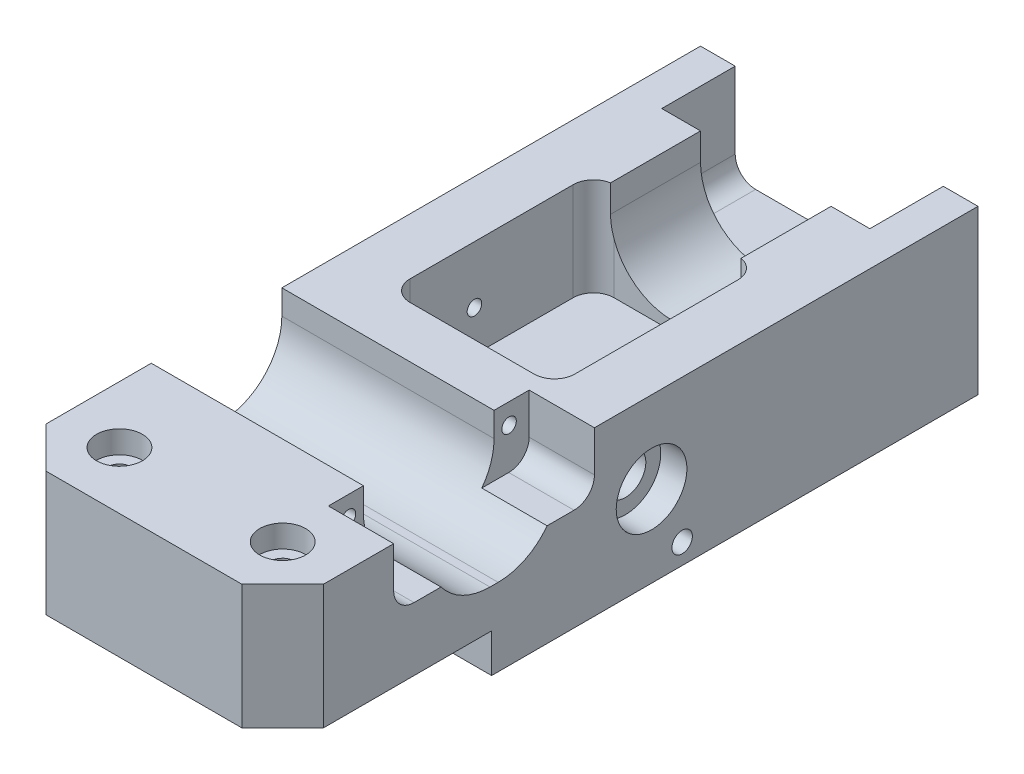
from build123d import *

# Parameters (mm, degrees)
BASE_DEPTH                    = 12.7
BASE_DEPTH_BACK               = 12.7
SKETCH1_W                     = 43.18
SKETCH1_H                     = 108.204
ACTUATORPLANECUT_DEPTH        = 6.0325
CENTERSLOT_DEPTH              = 60.619162222
CENTERSLOT_DEPTH_BACK         = 60.619162222
SKETCH5_W                     = 25.654
SKETCH5_H                     = 12.7
SHAFTGUIDE_REACH              = 113.065
SKETCH2_R                     = 4.7625
CENTERSLOTFILLET_R            = 3.175
GEARBOXPIT_DEPTH              = 11.176
FRONTCUTAWAY_DEPTH            = 15.24
GEARBOXSLOTSH_DEPTH           = 2.286
SKETCH55_R                    = 1.5875
GUIDEBARHOLE_DEPTH            = 71.376336961
PITCHSHAFTHOLE_DEPTH          = 60.619162279
PITCHSHAFTHOLE_DEPTH_BACK     = 60.619162279
SKETCH56_R                    = 3.175
SKETCH57_R                    = 5.5
BEARINGBORER_DEPTH            = 4.064
TOGGLEASSEMHOLES_D            = 2.7051
TOGGLEASSEMHOLES_DEPTH        = 9.398
TOGGLEASSEMHOLES_TIP          = 0.81269403
BACKCHAMFERS_SIZE             = 6.35
PITCHMOTORSLOT_DEPTH          = 71.37633704
PITCHMOTORMOUNTINGSLOTS_DEPTH = 10.16
PITCHMOTORMOUNTINGHOLES_D     = 2.2606
PITCHMOTORMOUNTINGHOLES_DEPTH = 7.5946
PITCHMOTORMOUNTINGHOLES_TIP   = 0.679152758
GEARBOXMOUNTINGHOLES_D        = 2.7051
GEARBOXMOUNTINGHOLES_DEPTH    = 9.398
GEARBOXMOUNTINGHOLES_TIP      = 0.81269403
CAPMOUNTINGHOLES_D            = 3.6576
CAPMOUNTINGHOLES_CBORE_D      = 7.14502
CAPMOUNTINGHOLES_CBORE_DEPTH  = 3.5052
ENCODERMOUNTINGHOLES_D        = 2.2606
ENCODERMOUNTINGHOLES_DEPTH    = 10.1346
ENCODERMOUNTINGHOLES_TIP      = 0.679152758
ROLLMOTORSLOT_REACH           = 113.065
ROLLMOTORMOUNTINGSLOTS_DEPTH  = 11.43
ROLLMOTORMOUNTINGHOLES_D      = 2.2606
ROLLMOTORMOUNTINGHOLES_DEPTH  = 7.62
ROLLMOTORMOUNTINGHOLES_TIP    = 0.679152758


with BuildPart() as part:
    # Sketch1 → Base (new, two sides: drawn at the far end of the back side and taken through both)
    with BuildSketch(Plane(origin=(0, 0, 0), x_dir=(1, 0, 0), z_dir=(0, 1, 0)).offset(-BASE_DEPTH_BACK)):
        Rectangle(SKETCH1_W, SKETCH1_H)
    extrude(amount=BASE_DEPTH + BASE_DEPTH_BACK)

    # Sketch3 → ActuatorPlaneCut (cut)
    with BuildSketch(Plane(origin=(0, -12.7, 0), x_dir=(-1, 0, 0), z_dir=(0, -1, 0))):
        Polygon((10.922, -21.59), (16.256, -21.59), (21.59, -21.59), (21.59, -54.102), (-21.59, -54.102), (-21.59, -21.59), (-10.922, -21.59), (-10.922, -4.826), (10.922, -4.826), align=None)
    extrude(amount=-ACTUATORPLANECUT_DEPTH, mode=Mode.SUBTRACT)

    # Sketch5 → CenterSlot (cut, two sides: drawn at the far end of the back side and taken through both)
    with BuildSketch(Plane(origin=(0, 0, 0), x_dir=(1, 0, 0), z_dir=(0, 1, 0)).offset(-CENTERSLOT_DEPTH_BACK)):
        with Locations((0, 3.302)):
            Rectangle(SKETCH5_W, SKETCH5_H)
    extrude(amount=CENTERSLOT_DEPTH + CENTERSLOT_DEPTH_BACK, mode=Mode.SUBTRACT)

    # Sketch2 → ShaftGuide (cut, up to next)
    with BuildSketch(Plane(origin=(0, 0, -54.102), x_dir=(-1, 0, 0), z_dir=(0, 0, -1)), mode=Mode.PRIVATE) as shaftguide_sk1:
        with Locations((0, -12.7)):
            Circle(SKETCH2_R)
    shaftguide_tool1 = extrude(shaftguide_sk1.sketch, amount=-SHAFTGUIDE_REACH, mode=Mode.PRIVATE) & part.part
    add(shaftguide_tool1.solids().sort_by_distance((0, -12.7, -54.102))[0], mode=Mode.SUBTRACT)

    # CenterSlotFillet
    centerslotfillet_edges = [part.edges().sort_by_distance(p)[0] for p in [
        (-12.827, 0, -9.652),
        (-12.827, 0, 3.048),
        (12.827, 0, 3.048),
        (12.827, 0, -9.652),
    ]]
    fillet(centerslotfillet_edges, radius=CENTERSLOTFILLET_R)

    # Sketch40 → GearBoxPit (cut)
    with BuildSketch(Plane.XZ.offset(12.7)):
        with BuildLine():
            Line((10.922, 0.508), (-10.922, 0.508))
            Line((-10.922, 0.508), (-10.922, 18.415))
            ThreePointArc((-10.922, 18.415), (-9.99206403, 20.66006403), (-7.747, 21.59))
            Line((-7.747, 21.59), (7.747, 21.59))
            ThreePointArc((7.747, 21.59), (9.99206403, 20.66006403), (10.922, 18.415))
            Line((10.922, 18.415), (10.922, 0.508))
        make_face()
    extrude(amount=-GEARBOXPIT_DEPTH, mode=Mode.SUBTRACT)

    # Sketch60 → FrontCutaway (cut)
    with BuildSketch(Plane(origin=(0, 12.7, 0), x_dir=(1, 0, 0), z_dir=(0, 1, 0))):
        with BuildLine():
            Line((-12.827, 6.477), (12.827, 6.477))
            Line((12.827, 6.477), (12.827, 25.527))
            ThreePointArc((12.827, 25.527), (11.89706403, 27.77206403), (9.652, 28.702))
            Line((9.652, 28.702), (-9.652, 28.702))
            ThreePointArc((-9.652, 28.702), (-11.89706403, 27.77206403), (-12.827, 25.527))
            Line((-12.827, 25.527), (-12.827, 6.477))
        make_face()
    extrude(amount=-FRONTCUTAWAY_DEPTH, mode=Mode.SUBTRACT)

    # Sketch67 → GearBoxSlotsH (cut)
    with BuildSketch(Plane(origin=(0, -12.7, 0), x_dir=(-1, 0, 0), z_dir=(0, -1, 0))):
        with BuildLine():
            Line((-12.3825, -6.461125), (12.3825, -6.461125))
            ThreePointArc((12.3825, -6.461125), (12.779375, -6.858), (12.3825, -7.254875))
            Line((12.3825, -7.254875), (-12.3825, -7.254875))
            ThreePointArc((-12.3825, -7.254875), (-12.779375, -6.858), (-12.3825, -6.461125))
        make_face()
        with BuildLine():
            Line((-12.3825, -17.129125), (12.3825, -17.129125))
            ThreePointArc((12.3825, -17.129125), (12.779375, -17.526), (12.3825, -17.922875))
            Line((12.3825, -17.922875), (-12.3825, -17.922875))
            ThreePointArc((-12.3825, -17.922875), (-12.779375, -17.526), (-12.3825, -17.129125))
        make_face()
    extrude(amount=-GEARBOXSLOTSH_DEPTH, mode=Mode.SUBTRACT)

    # Sketch55 → GuideBarHole (cut, through all)
    with BuildSketch(Plane.ZY.offset(21.59)):
        with Locations((-8.0645, -9.525)):
            Circle(SKETCH55_R)
    extrude(amount=-GUIDEBARHOLE_DEPTH, mode=Mode.SUBTRACT)

    # Sketch56 → PitchShaftHole (cut, two sides: drawn at the far end of the back side and taken through both)
    with BuildSketch(Plane(origin=(0, 0, 0), x_dir=(0, 0, -1), z_dir=(1, 0, 0)).offset(-PITCHSHAFTHOLE_DEPTH_BACK)):
        with Locations((3.302, 0)):
            Circle(SKETCH56_R)
    extrude(amount=PITCHSHAFTHOLE_DEPTH + PITCHSHAFTHOLE_DEPTH_BACK, mode=Mode.SUBTRACT)

    # Sketch57 → BearingBoreR (cut)
    with BuildSketch(Plane.ZY.offset(21.59)):
        with Locations((-3.302, 0)):
            Circle(SKETCH57_R)
    bearingborer = extrude(amount=-BEARINGBORER_DEPTH, mode=Mode.SUBTRACT)

    # BearingBoreL: BearingBoreR across plane
    add(bearingborer.mirror(Plane(origin=(0, 0, 0), x_dir=(0, 0, 1), z_dir=(1, 0, 0))), mode=Mode.SUBTRACT)

    # ToggleAssemHoles
    with Locations(Plane(origin=(0, -12.7, 0), x_dir=(-1, 0, 0), z_dir=(0, -1, 0))):
        with Locations((15.875, 22.352), (-15.875, 22.352)):
            Hole(TOGGLEASSEMHOLES_D / 2, depth=TOGGLEASSEMHOLES_DEPTH)
            with Locations((0, 0, -(TOGGLEASSEMHOLES_DEPTH + TOGGLEASSEMHOLES_TIP / 2))):  # 118° drill point
                Cone(0, TOGGLEASSEMHOLES_D / 2, TOGGLEASSEMHOLES_TIP, mode=Mode.SUBTRACT)

    # BackChamfers
    backchamfers_edges = [part.edges().sort_by_distance(p)[0] for p in [
        (21.59, 3.01625, 54.102),
        (-21.59, 3.01625, 54.102),
    ]]
    chamfer(backchamfers_edges, length=BACKCHAMFERS_SIZE)

    # Sketch62 → PitchMotorSlot (cut, through all)
    with BuildSketch(Plane.ZY.offset(21.59)):
        with BuildLine():
            Line((11.049, 9.525), (11.049, 12.7))
            Line((11.049, 12.7), (31.369, 12.7))
            Line((31.369, 12.7), (31.369, 9.525))
            Line((31.369, 9.525), (31.369, 8.89))
            ThreePointArc((31.369, 8.89), (28.579192091, 2.154807909), (21.844, -0.635))
            Line((21.844, -0.635), (20.574, -0.635))
            ThreePointArc((20.574, -0.635), (13.838807909, 2.154807909), (11.049, 8.89))
            Line((11.049, 8.89), (11.049, 9.525))
        make_face()
    extrude(amount=-PITCHMOTORSLOT_DEPTH, mode=Mode.SUBTRACT)

    # Sketch63 → PitchMotorMountingSlots (cut)
    with BuildSketch(Plane.ZY.offset(-21.59)):
        with BuildLine():
            Line((5.588, 12.7), (36.83, 12.7))
            Line((36.83, 12.7), (36.83, 6.35))
            ThreePointArc((36.83, 6.35), (35.90006403, 4.10493597), (33.655, 3.175))
            Line((33.655, 3.175), (8.763, 3.175))
            ThreePointArc((8.763, 3.175), (6.51793597, 4.10493597), (5.588, 6.35))
            Line((5.588, 6.35), (5.588, 12.7))
        make_face()
    extrude(amount=PITCHMOTORMOUNTINGSLOTS_DEPTH, mode=Mode.SUBTRACT)

    # PitchMotorMountingHoles
    with Locations(Plane(origin=(11.43, 0, 0), x_dir=(0, 0, -1), z_dir=(1, 0, 0))):
        with Locations((-33.7058, 9.525), (-8.7122, 9.525)):
            Hole(PITCHMOTORMOUNTINGHOLES_D / 2, depth=PITCHMOTORMOUNTINGHOLES_DEPTH)
            with Locations((0, 0, -(PITCHMOTORMOUNTINGHOLES_DEPTH + PITCHMOTORMOUNTINGHOLES_TIP / 2))):  # 118° drill point
                Cone(0, PITCHMOTORMOUNTINGHOLES_D / 2, PITCHMOTORMOUNTINGHOLES_TIP, mode=Mode.SUBTRACT)

    # GearBoxMountingHoles
    with Locations(Plane(origin=(0, -12.7, 0), x_dir=(-1, 0, 0), z_dir=(0, -1, 0))):
        with Locations((-16.256, -12.192), (16.256, -12.192)):
            Hole(GEARBOXMOUNTINGHOLES_D / 2, depth=GEARBOXMOUNTINGHOLES_DEPTH)
            with Locations((0, 0, -(GEARBOXMOUNTINGHOLES_DEPTH + GEARBOXMOUNTINGHOLES_TIP / 2))):  # 118° drill point
                Cone(0, GEARBOXMOUNTINGHOLES_D / 2, GEARBOXMOUNTINGHOLES_TIP, mode=Mode.SUBTRACT)

    # CapMountingHoles (through all)
    with Locations(Plane(origin=(-0.837932951, 12.7, 8.633720573), x_dir=(-1, 0, 0), z_dir=(0, 1, 0))):
        with Locations((-13.537932951, 36.578279427), (11.862067049, 36.578279427)):
            CounterBoreHole(CAPMOUNTINGHOLES_D / 2, CAPMOUNTINGHOLES_CBORE_D / 2, CAPMOUNTINGHOLES_CBORE_DEPTH)

    # EncoderMountingHoles
    with Locations(Plane.ZY.offset(21.59)):
        with Locations((3.556, 3.81), (-10.16, 3.81)):
            Hole(ENCODERMOUNTINGHOLES_D / 2, depth=ENCODERMOUNTINGHOLES_DEPTH)
            with Locations((0, 0, -(ENCODERMOUNTINGHOLES_DEPTH + ENCODERMOUNTINGHOLES_TIP / 2))):  # 118° drill point
                Cone(0, ENCODERMOUNTINGHOLES_D / 2, ENCODERMOUNTINGHOLES_TIP, mode=Mode.SUBTRACT)

    # Sketch81 → RollMotorSlot (cut, up to next)
    with BuildSketch(Plane(origin=(0, 0, -54.102), x_dir=(-1, 0, 0), z_dir=(0, 0, -1)), mode=Mode.PRIVATE) as rollmotorslot_sk1:
        with BuildLine():
            Line((10.16, 12.7), (-10.16, 12.7))
            Line((-10.16, 12.7), (-10.16, 8.46582))
            ThreePointArc((-10.16, 8.46582), (-7.370192091, 1.730627909), (-0.635, -1.05918))
            Line((-0.635, -1.05918), (0.635, -1.05918))
            ThreePointArc((0.635, -1.05918), (7.370192091, 1.730627909), (10.16, 8.46582))
            Line((10.16, 8.46582), (10.16, 12.7))
        make_face()
    rollmotorslot_tool1 = extrude(rollmotorslot_sk1.sketch, amount=-ROLLMOTORSLOT_REACH, mode=Mode.PRIVATE) & part.part
    add(rollmotorslot_tool1.solids().sort_by_distance((0, 6.589347, -54.102))[0], mode=Mode.SUBTRACT)

    # Sketch84 → RollMotorMountingSlots (cut)
    with BuildSketch(Plane(origin=(0, 0, -54.102), x_dir=(-1, 0, 0), z_dir=(0, 0, -1))):
        with BuildLine():
            Line((16.1925, 12.7), (-16.1925, 12.7))
            Line((-16.1925, 12.7), (-16.1925, 0.84582))
            ThreePointArc((-16.1925, 0.84582), (-15.26256403, -1.39924403), (-13.0175, -2.32918))
            Line((-13.0175, -2.32918), (13.0175, -2.32918))
            ThreePointArc((13.0175, -2.32918), (15.26256403, -1.39924403), (16.1925, 0.84582))
            Line((16.1925, 0.84582), (16.1925, 12.7))
        make_face()
    extrude(amount=-ROLLMOTORMOUNTINGSLOTS_DEPTH, mode=Mode.SUBTRACT)

    # RollMotorMountingHoles
    with Locations(Plane(origin=(0, 0, -42.672), x_dir=(-1, 0, 0), z_dir=(0, 0, -1))):
        with Locations((12.5, 8.46582), (-12.5, 8.46582)):
            Hole(ROLLMOTORMOUNTINGHOLES_D / 2, depth=ROLLMOTORMOUNTINGHOLES_DEPTH)
            with Locations((0, 0, -(ROLLMOTORMOUNTINGHOLES_DEPTH + ROLLMOTORMOUNTINGHOLES_TIP / 2))):  # 118° drill point
                Cone(0, ROLLMOTORMOUNTINGHOLES_D / 2, ROLLMOTORMOUNTINGHOLES_TIP, mode=Mode.SUBTRACT)


solid = part.part
